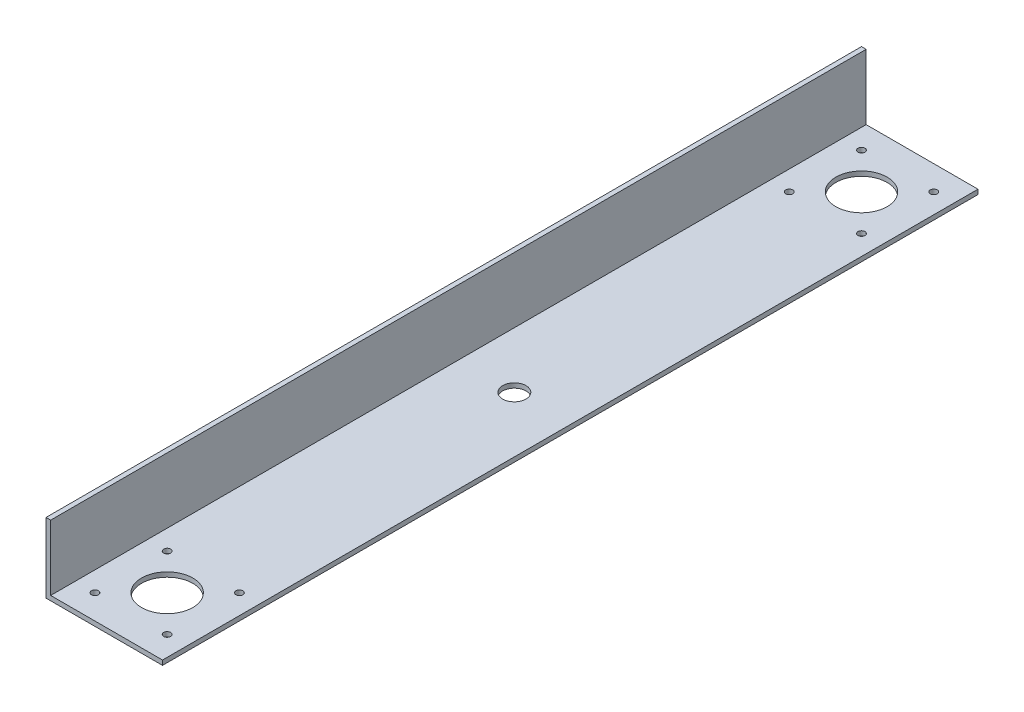
from build123d import *

# Parameters (mm, degrees)
BOSS_EXTRUDE1_DEPTH = 350
SKETCH6_R           = 1.5
CUT_EXTRUDE3_DEPTH  = 355.660400947
SKETCH7_R           = 11
CUT_EXTRUDE4_DEPTH  = 355.660400947
SKETCH8_R           = 11
CUT_EXTRUDE5_DEPTH  = 355.823899984
SKETCH9_R           = 1.5
CUT_EXTRUDE6_DEPTH  = 355.823899984
SKETCH10_R          = 5
CUT_EXTRUDE7_DEPTH  = 355.823899984


with BuildPart() as part:
    # Sketch1 → Boss-Extrude1 (new body)
    with BuildSketch(Plane.XY):
        Polygon((0, 0), (0, 30), (2, 30), (2, 2), (50, 2), (50, 0), align=None)
    extrude(amount=BOSS_EXTRUDE1_DEPTH)

    # Sketch6 → Cut-Extrude3 (cut, through all)
    with BuildSketch(Plane(origin=(0, 2, 0), x_dir=(1, 0, 0), z_dir=(0, 1, 0))):
        with Locations((41.5, -339.5)):
            Circle(SKETCH6_R)
        with Locations((10.5, -308.5)):
            Circle(SKETCH6_R)
        with Locations((10.5, -339.5)):
            Circle(SKETCH6_R)
        with Locations((41.5, -308.5)):
            Circle(SKETCH6_R)
    extrude(amount=-CUT_EXTRUDE3_DEPTH, mode=Mode.SUBTRACT)

    # Sketch7 → Cut-Extrude4 (cut, through all)
    with BuildSketch(Plane(origin=(0, 2, 0), x_dir=(1, 0, 0), z_dir=(0, 1, 0))):
        with Locations((26, -324)):
            Circle(SKETCH7_R)
    extrude(amount=-CUT_EXTRUDE4_DEPTH, mode=Mode.SUBTRACT)

    # Sketch8 → Cut-Extrude5 (cut, through all)
    with BuildSketch(Plane(origin=(0, 0, 0), x_dir=(-1, 0, 0), z_dir=(0, -1, 0))):
        with Locations((-26, -26)):
            Circle(SKETCH8_R)
    extrude(amount=-CUT_EXTRUDE5_DEPTH, mode=Mode.SUBTRACT)

    # Sketch9 → Cut-Extrude6 (cut, through all)
    with BuildSketch(Plane.XZ):
        with Locations((41.5, 41.5)):
            Circle(SKETCH9_R)
        with Locations((10.5, 41.5)):
            Circle(SKETCH9_R)
        with Locations((10.5, 10.5)):
            Circle(SKETCH9_R)
        with Locations((41.5, 10.5)):
            Circle(SKETCH9_R)
    extrude(amount=-CUT_EXTRUDE6_DEPTH, mode=Mode.SUBTRACT)

    # Sketch10 → Cut-Extrude7 (cut, through all)
    with BuildSketch(Plane.XZ):
        with Locations((26.000000572, 175)):
            Circle(SKETCH10_R)
    extrude(amount=-CUT_EXTRUDE7_DEPTH, mode=Mode.SUBTRACT)


solid = part.part
